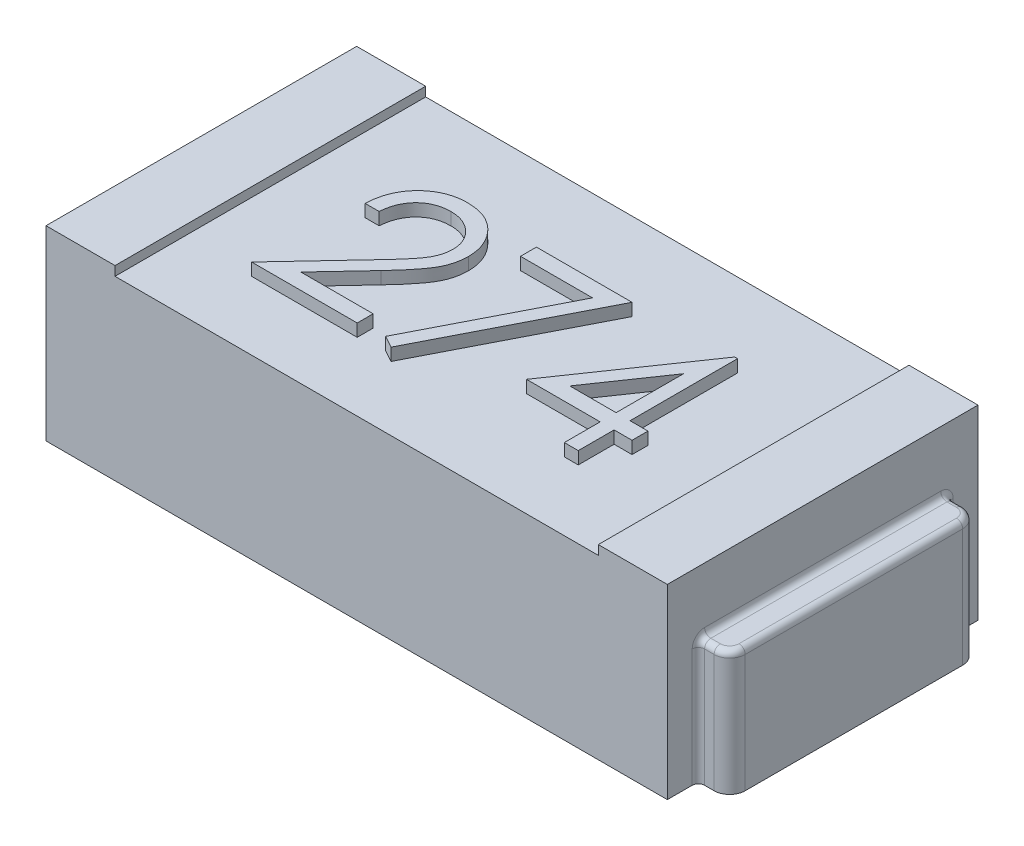
from build123d import *

# Parameters (mm, degrees)
ESQUISSE1_W             = 2
ESQUISSE1_H             = 1
BOSS_EXTRU_1_DEPTH      = 0.6
ESQUISSE2_W             = 1.555645222
ESQUISSE2_H             = 1
ENL_V_MAT_EXTRU_1_DEPTH = 0.03
BOSS_EXTRU_2_DEPTH      = 0.4
CONG_1_R                = 0.02
CONG_1_OF_SYM_TRIE2_R   = 0.02
BOSS_EXTRU_3_DEPTH      = 0.04


with BuildPart() as part:
    # Esquisse1 → Boss.-Extru.1 (new body)
    with BuildSketch(Plane(origin=(0, 0, 0), x_dir=(1, 0, 0), z_dir=(0, 1, 0))):
        Rectangle(ESQUISSE1_W, ESQUISSE1_H)
    extrude(amount=BOSS_EXTRU_1_DEPTH)

    # Esquisse2 → Enlèv. mat.-Extru.1 (cut)
    with BuildSketch(Plane(origin=(0, 0.6, 0), x_dir=(1, 0, 0), z_dir=(0, 1, 0))):
        Rectangle(ESQUISSE2_W, ESQUISSE2_H)
    extrude(amount=-ENL_V_MAT_EXTRU_1_DEPTH, mode=Mode.SUBTRACT)

    # Esquisse3 → Boss.-Extru.2 (add)
    with BuildSketch(Plane(origin=(0, 0, 0), x_dir=(1, 0, 0), z_dir=(0, 1, 0))):
        with BuildLine():
            Line((1, 0.4), (1.050552667, 0.4))
            ThreePointArc((1.050552667, 0.4), (1.085908006, 0.385355339), (1.100552667, 0.35))
            Line((1.100552667, 0.35), (1.100552667, -0.35))
            ThreePointArc((1.100552667, -0.35), (1.085908006, -0.385355339), (1.050552667, -0.4))
            Line((1.050552667, -0.4), (1, -0.4))
            Line((1, -0.4), (1, 0.4))
        make_face()
    boss_extru_2 = extrude(amount=BOSS_EXTRU_2_DEPTH)

    # Congé1
    cong_1_edges = [part.edges().sort_by_distance(p)[0] for p in [
        (1, 0.2, -0.4),
        (1, 0.2, 0.4),
        (1.025276334, 0.4, -0.4),
        (1.085908006, 0.4, -0.385355339),
        (1.100552667, 0.4, 0),
        (1.085908006, 0.4, 0.385355339),
        (1.025276334, 0.4, 0.4),
        (1, 0.4, 0),
    ]]
    fillet(cong_1_edges, radius=CONG_1_R)

    # Symétrie2: Boss.-Extru.2 across plane
    add(boss_extru_2.mirror(Plane(origin=(0, 0, 0), x_dir=(0, 0, 1), z_dir=(1, 0, 0))))

    # Congé1 of Symétrie2
    cong_1_of_sym_trie2_edges = [part.edges().sort_by_distance(p)[0] for p in [
        (-1, 0.2, -0.4),
        (-1, 0.2, 0.4),
        (-1.025276334, 0.4, -0.4),
        (-1.085908006, 0.4, -0.385355339),
        (-1.100552667, 0.4, 0),
        (-1.085908006, 0.4, 0.385355339),
        (-1.025276334, 0.4, 0.4),
        (-1, 0.4, 0),
    ]]
    fillet(cong_1_of_sym_trie2_edges, radius=CONG_1_OF_SYM_TRIE2_R)

    # Esquisse4 → Boss.-Extru.3 (add)
    # profile 1 of 3: a face of its own
    with BuildSketch(Plane(origin=(0, 0.57, 0), x_dir=(1, 0, 0), z_dir=(0, 1, 0))):
        Polygon((0.48447516, 0.23252099), (0.493589744, 0.23252099), (0.493589744, -0.113632856), (0.551282051, -0.113632856), (0.551282051, -0.164914907), (0.493589744, -0.164914907), (0.493589744, -0.280299523), (0.448717949, -0.280299523), (0.448717949, -0.164914907), (0.211538462, -0.164914907), align=None)
        Polygon((0.448717949, -0.113632856), (0.448717949, 0.10351458), (0.299679487, -0.113632856), align=None, mode=Mode.SUBTRACT)
    # profile 2 of 3: a face of its own
    with BuildSketch(Plane(origin=(0, 0.57, 0), x_dir=(1, 0, 0), z_dir=(0, 1, 0))):
        Polygon((-0.141025641, 0.219700477), (0.166666667, 0.219700477), (-0.096153846, -0.293120035), (-0.134915865, -0.271785901), (0.090745192, 0.168418426), (-0.141025641, 0.168418426), align=None)
    # profile 3 of 3: a face of its own
    with BuildSketch(Plane(origin=(0, 0.57, 0), x_dir=(1, 0, 0), z_dir=(0, 1, 0))):
        with BuildLine():
            Line((-0.493589744, 0.065854324), (-0.538461538, 0.065854324))
            add(Edge.make_bspline(
                [(-0.538461538, 0.065854324), (-0.538169088, 0.071807307), (-0.537594723, 0.08349881), (-0.534904968, 0.100545082), (-0.531056271, 0.116838625), (-0.525614635, 0.132248612), (-0.518856595, 0.146911299), (-0.510752305, 0.160768444), (-0.501153184, 0.173767185), (-0.490266507, 0.18578702), (-0.478442416, 0.196813816), (-0.465684425, 0.206335994), (-0.452277992, 0.214381375), (-0.438263792, 0.221107267), (-0.423483712, 0.226155816), (-0.408071875, 0.229901765), (-0.39196057, 0.232155528), (-0.380983424, 0.232397784), (-0.375400641, 0.23252099)],
                knots=[0, 0, 0, 0, 1.10065271, 2.161652631, 3.183658789, 4.190468796, 5.17591951, 6.163126047, 7.15150782, 8.156236427, 9.156009102, 10.134482811, 11.092018607, 12.041330605, 13.001268258, 13.972401359, 14.968799086, 16, 16, 16, 16], degree=3))
            add(Edge.make_bspline(
                [(-0.375400641, 0.23252099), (-0.369918059, 0.232392639), (-0.359144981, 0.232140434), (-0.343421836, 0.229974573), (-0.328453651, 0.226582346), (-0.314269685, 0.221823), (-0.300983104, 0.215425225), (-0.288494098, 0.207739862), (-0.276653982, 0.198851315), (-0.26599587, 0.188386485), (-0.256209001, 0.177214715), (-0.247765822, 0.165287872), (-0.24053537, 0.152969403), (-0.234508559, 0.140165374), (-0.230071968, 0.126755227), (-0.226703652, 0.112934198), (-0.224799736, 0.098559225), (-0.224507533, 0.088829717), (-0.224358974, 0.08388317)],
                knots=[0, 0, 0, 0, 1.111607364, 2.184268762, 3.212621178, 4.221274766, 5.211760367, 6.196651075, 7.1921475, 8.207485113, 9.220403448, 10.201281604, 11.166441695, 12.114753415, 13.065576456, 14.026450734, 14.996634279, 16, 16, 16, 16], degree=3))
            add(Edge.make_bspline(
                [(-0.224358974, 0.08388317), (-0.224600869, 0.076919193), (-0.225080414, 0.063113449), (-0.229182467, 0.042825611), (-0.235589112, 0.023169408), (-0.24330302, 0.007349794), (-0.251084798, -0.005397848), (-0.258097299, -0.015893378), (-0.266306557, -0.027194159), (-0.275832057, -0.03926235), (-0.286476753, -0.052192479), (-0.298337062, -0.065976736), (-0.31149756, -0.080472703), (-0.320734488, -0.090373503), (-0.325520833, -0.09550385)],
                knots=[0, 0, 0, 0, 1.184426356, 2.348067706, 3.509069118, 4.696110526, 5.333549288, 6.050745305, 6.844228056, 7.710549037, 8.667450064, 9.695053472, 10.805634456, 12, 12, 12, 12], degree=3))
            Line((-0.325520833, -0.09550385), (-0.450620994, -0.229017471))
            Line((-0.450620994, -0.229017471), (-0.217948718, -0.229017471))
            Line((-0.217948718, -0.229017471), (-0.217948718, -0.280299523))
            Line((-0.217948718, -0.280299523), (-0.557692308, -0.280299523))
            Line((-0.557692308, -0.280299523), (-0.363782051, -0.073368433))
            add(Edge.make_bspline(
                [(-0.363782051, -0.073368433), (-0.359060925, -0.068440103), (-0.349992606, -0.058973791), (-0.337166524, -0.045153368), (-0.325646669, -0.032332005), (-0.31535847, -0.020533927), (-0.306525112, -0.00958656), (-0.298686221, 0.000155541), (-0.292405423, 0.009120462), (-0.285588938, 0.019511978), (-0.27898694, 0.032199452), (-0.273313747, 0.047704265), (-0.269854482, 0.063665301), (-0.269439506, 0.074451306), (-0.269230769, 0.079876759)],
                knots=[0, 0, 0, 0, 1.329631726, 2.553950428, 3.673215718, 4.687767853, 5.603093632, 6.413772471, 7.123043292, 7.734684054, 8.834405432, 9.900288307, 10.943827018, 12, 12, 12, 12], degree=3))
            add(Edge.make_bspline(
                [(-0.269230769, 0.079876759), (-0.26932159, 0.083288388), (-0.269500579, 0.090012052), (-0.27108025, 0.099870018), (-0.273467465, 0.109379277), (-0.276888216, 0.11856908), (-0.281403465, 0.12734703), (-0.286899662, 0.135723813), (-0.2932411, 0.143822236), (-0.300576995, 0.151415565), (-0.308635784, 0.158370023), (-0.317149248, 0.164530606), (-0.326156406, 0.169679051), (-0.33561928, 0.17389955), (-0.34551149, 0.177210319), (-0.355852168, 0.179504402), (-0.366612742, 0.180944757), (-0.373960384, 0.181139638), (-0.377704327, 0.181238939)],
                knots=[0, 0, 0, 0, 0.991446411, 1.95395049, 2.89581595, 3.838931463, 4.798493298, 5.75982156, 6.748411868, 7.785213223, 8.824556874, 9.840280684, 10.836137867, 11.835679398, 12.848801643, 13.863922112, 14.911575587, 16, 16, 16, 16], degree=3))
            add(Edge.make_bspline(
                [(-0.377704327, 0.181238939), (-0.381614446, 0.181136791), (-0.389293274, 0.180936191), (-0.400567421, 0.179532953), (-0.411322533, 0.177112119), (-0.421585662, 0.173801165), (-0.431374174, 0.169592801), (-0.440640466, 0.164351123), (-0.449363736, 0.158096338), (-0.457560382, 0.15100483), (-0.465112379, 0.143109459), (-0.471747647, 0.134308036), (-0.477545363, 0.124761262), (-0.482603825, 0.114494898), (-0.486711781, 0.103415786), (-0.489850802, 0.091563257), (-0.492334638, 0.078988774), (-0.493164426, 0.07030519), (-0.493589744, 0.065854324)],
                knots=[0, 0, 0, 0, 1.031018746, 2.02475058, 2.990194455, 3.934040569, 4.864654155, 5.795059489, 6.735614925, 7.690564532, 8.649604399, 9.611025574, 10.590972636, 11.591080095, 12.624614302, 13.701020113, 14.821632451, 16, 16, 16, 16], degree=3))
        make_face()
    extrude(amount=BOSS_EXTRU_3_DEPTH)


solid = part.part
